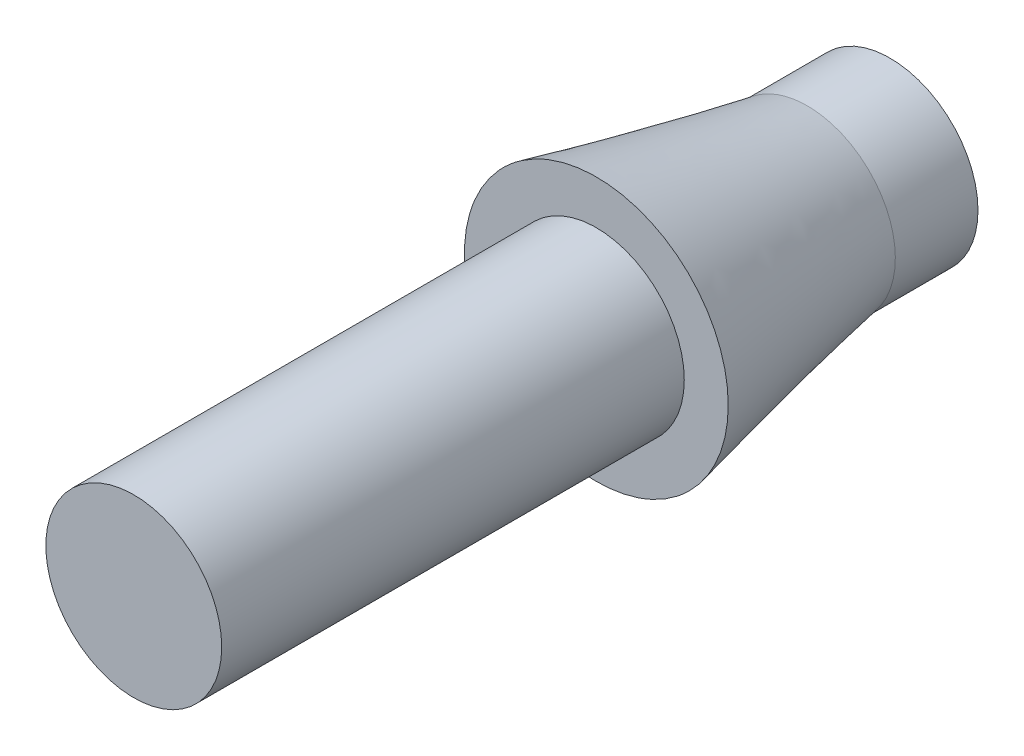
from build123d import *

# Parameters (mm, degrees)
SKETCH1_R           = 5
BOSS_EXTRUDE1_DEPTH = 43


with BuildPart() as part:
    # Sketch1 → Boss-Extrude1 (new body)
    with BuildSketch(Plane.XY):
        Circle(SKETCH1_R)
    extrude(amount=BOSS_EXTRUDE1_DEPTH)

    # Loft1: read off the stored shape, not the designer's step
    # Loft1: loft between two sections, ruled curve by curve
    loft1_from = [
        Edge.make_bspline([(3.922756434, -6.392337754, 16.7), (-8.861919074, -14.237850621, 16.7), (-16.707431942, -1.453175113, 16.7), (-3.922756434, 6.392337754, 16.7), (8.861919074, 14.237850621, 16.7), (16.707431942, 1.453175113, 16.7), (3.922756434, -6.392337754, 16.7)], [0, 0, 0, 0, 0.5, 0.5, 0.5, 1, 1, 1, 1], 3, [1, 0.333333333, 0.333333333, 1, 0.333333333, 0.333333333, 1]),
    ]
    loft1_to = [
        Edge.make_bspline([(3.830446581, -3.213670641, 4.7), (-2.5968947, -10.874563804, 4.7), (-10.257787863, -4.447222522, 4.7), (-3.830446581, 3.213670641, 4.7), (2.5968947, 10.874563804, 4.7), (10.257787863, 4.447222522, 4.7), (3.830446581, -3.213670641, 4.7)], [0, 0, 0, 0, 0.5, 0.5, 0.5, 1, 1, 1, 1], 3, [1, 0.333333333, 0.333333333, 1, 0.333333333, 0.333333333, 1]),
    ]
    loft1 = Solid(Shell([*[Face.make_surface_from_curves(loft1_from[k], loft1_to[k]) for k in range(1)], Face(Wire(loft1_from)), Face(Wire(loft1_to))]))
    add(loft1)


solid = part.part
